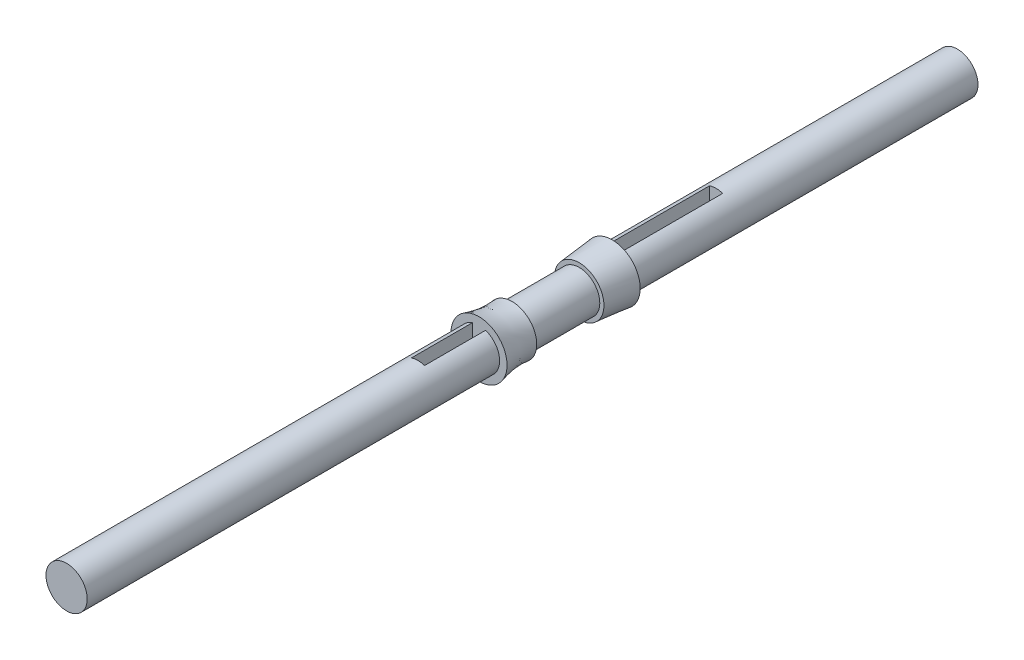
from build123d import *

# Parameters (mm, degrees)
SKETCH1_R           = 12.5
BOSS_EXTRUDE1_DEPTH = 500
SKETCH6_R           = 12.5
BOSS_EXTRUDE2_DEPTH = 40
CUT_EXTRUDE1_DEPTH  = 10
SKETCH8_W           = 8
SKETCH8_H           = 37
CUT_EXTRUDE2_DEPTH  = 10


with BuildPart() as part:
    # Sketch1 → Boss-Extrude1 (new body)
    with BuildSketch(Plane.XY):
        Circle(SKETCH1_R)
    extrude(amount=BOSS_EXTRUDE1_DEPTH)

    # Loft1: read off the stored shape, not the designer's step
    # Loft1: loft between two sections, ruled curve by curve
    loft1_from = [
        Edge.make_bspline([(12.212340856, -8.709691775, 229.275), (-5.207042693, -33.134373487, 229.275), (-29.631724406, -15.714989938, 229.275), (-12.212340856, 8.709691775, 229.275), (5.207042693, 33.134373487, 229.275), (29.631724406, 15.714989938, 229.275), (12.212340856, -8.709691775, 229.275)], [0, 0, 0, 0, 0.5, 0.5, 0.5, 1, 1, 1, 1], 3, [1, 0.333333333, 0.333333333, 1, 0.333333333, 0.333333333, 1]),
    ]
    loft1_to = [
        Edge.make_bspline([(11.08117333, -12.89215256, 209.275), (-14.70313179, -35.05449922, 209.275), (-36.86547845, -9.2701941, 209.275), (-11.08117333, 12.89215256, 209.275), (14.70313179, 35.05449922, 209.275), (36.86547845, 9.2701941, 209.275), (11.08117333, -12.89215256, 209.275)], [0, 0, 0, 0, 0.5, 0.5, 0.5, 1, 1, 1, 1], 3, [1, 0.333333333, 0.333333333, 1, 0.333333333, 0.333333333, 1]),
    ]
    loft1 = Solid(Shell([*[Face.make_surface_from_curves(loft1_from[k], loft1_to[k]) for k in range(1)], Face(Wire(loft1_from)), Face(Wire(loft1_to))]))
    add(loft1)

    # Loft2: read off the stored shape, not the designer's step
    # Loft2: loft between two sections, ruled curve by curve
    loft2_from = [
        Edge.make_bspline([(-16.92047911, -1.642372271, 290), (-20.205223652, 32.19858595, 290), (13.635734568, 35.483330492, 290), (16.92047911, 1.642372271, 290), (20.205223652, -32.19858595, 290), (-13.635734568, -35.483330492, 290), (-16.92047911, -1.642372271, 290)], [0, 0, 0, 0, 0.5, 0.5, 0.5, 1, 1, 1, 1], 3, [1, 0.333333333, 0.333333333, 1, 0.333333333, 0.333333333, 1]),
    ]
    loft2_to = [
        Edge.make_bspline([(-12.135254916, 8.816778784, 270), (5.498302653, 33.087288616, 270), (29.768812484, 15.453731047, 270), (12.135254916, -8.816778784, 270), (-5.498302653, -33.087288616, 270), (-29.768812484, -15.453731047, 270), (-12.135254916, 8.816778784, 270)], [0, 0, 0, 0, 0.5, 0.5, 0.5, 1, 1, 1, 1], 3, [1, 0.333333333, 0.333333333, 1, 0.333333333, 0.333333333, 1]),
    ]
    loft2 = Solid(Shell([*[Face.make_surface_from_curves(loft2_from[k], loft2_to[k]) for k in range(1)], Face(Wire(loft2_from)), Face(Wire(loft2_to))]))
    add(loft2)

    # Sketch6 → Boss-Extrude2 (add)
    with BuildSketch(Plane.XY.offset(500)):
        Circle(SKETCH6_R)
    extrude(amount=BOSS_EXTRUDE2_DEPTH)

    # Sketch9 → Cut-Extrude1 (cut)
    with BuildSketch(Plane(origin=(0, 12.5, 0), x_dir=(1, 0, 0), z_dir=(0, 1, 0))):
        Polygon((-4, -146.275), (-4, -209.275), (0, -209.275), (4, -209.275), (4, -146.275), align=None)
    extrude(amount=-CUT_EXTRUDE1_DEPTH, mode=Mode.SUBTRACT)

    # Sketch8 → Cut-Extrude2 (cut)
    with BuildSketch(Plane(origin=(0, 12.5, 0), x_dir=(1, 0, 0), z_dir=(0, 1, 0))):
        with Locations((0, -308.5)):
            Rectangle(SKETCH8_W, SKETCH8_H)
    extrude(amount=-CUT_EXTRUDE2_DEPTH, mode=Mode.SUBTRACT)


solid = part.part
